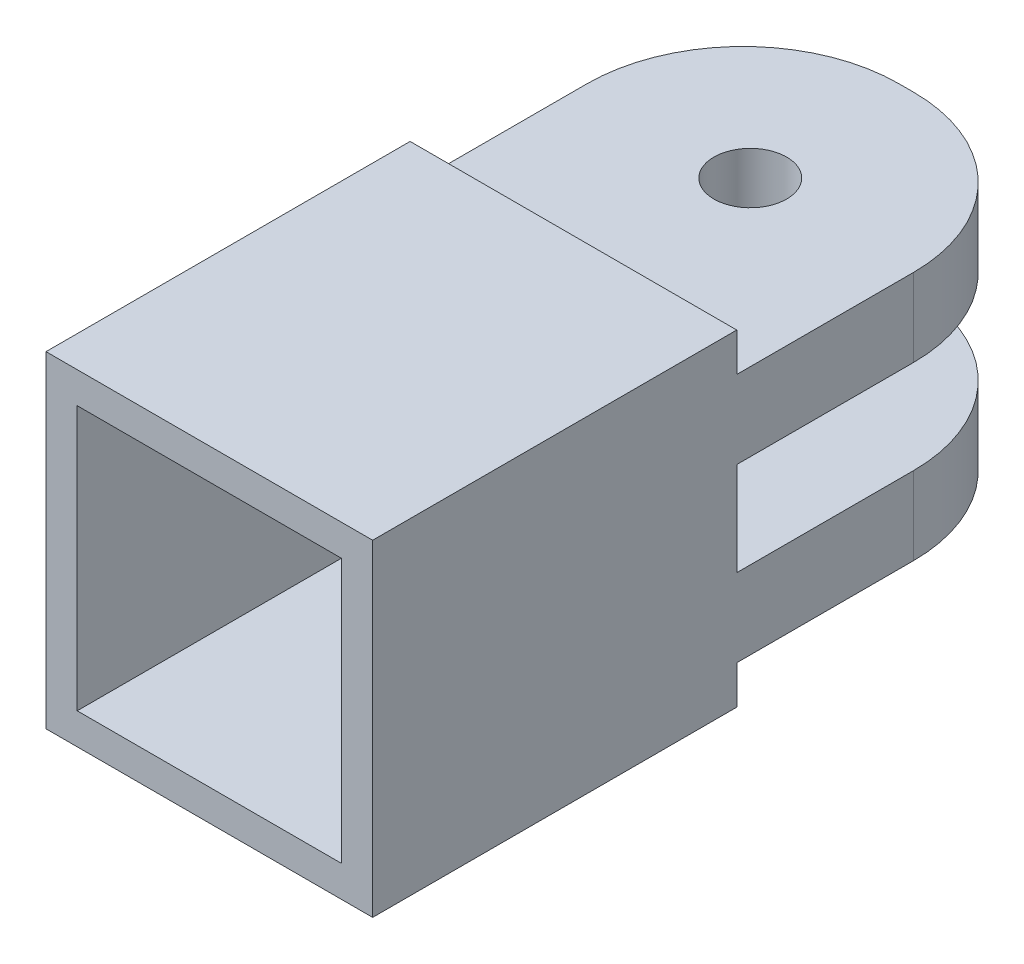
from build123d import *

# Parameters (mm, degrees)
SKETCH1_W           = 31.4
SKETCH1_H           = 31.4
SKETCH1_W_2         = 25.4
SKETCH1_H_2         = 25.4
BOSS_EXTRUDE1_DEPTH = 30
SKETCH2_W           = 31.4
SKETCH2_H           = 31.4
BOSS_EXTRUDE2_DEPTH = 5
SKETCH3_W           = 31.4
SKETCH3_H           = 7.5
BOSS_EXTRUDE3_DEPTH = 5
SKETCH6_R           = 3.5
BOSS_EXTRUDE6_DEPTH = 7.5


with BuildPart() as part:
    # Sketch1 → Boss-Extrude1 (new body)
    with BuildSketch(Plane.XY):
        Rectangle(SKETCH1_W, SKETCH1_H)
        Rectangle(SKETCH1_W_2, SKETCH1_H_2, mode=Mode.SUBTRACT)
    extrude(amount=BOSS_EXTRUDE1_DEPTH)

    # Sketch2 → Boss-Extrude2 (add)
    with BuildSketch(Plane(origin=(0, 0, 0), x_dir=(-1, 0, 0), z_dir=(0, 0, -1))):
        Rectangle(SKETCH2_W, SKETCH2_H)
    extrude(amount=BOSS_EXTRUDE2_DEPTH)

    # Sketch3 → Boss-Extrude3 (add)
    with BuildSketch(Plane(origin=(0, 0, -5), x_dir=(-1, 0, 0), z_dir=(0, 0, -1))):
        with Locations((0, 8.25)):
            Rectangle(SKETCH3_W, SKETCH3_H)
    boss_extrude3 = extrude(amount=BOSS_EXTRUDE3_DEPTH)

    # Sketch6 → Boss-Extrude6 (add)
    with BuildSketch(Plane(origin=(0, 12, 0), x_dir=(1, 0, 0), z_dir=(0, 1, 0))):
        with BuildLine():
            Line((-15.7, 10), (-15.7, 22))
            ThreePointArc((-15.7, 22), (-11.306601718, 32.606601718), (-0.7, 37))
            Line((-0.7, 37), (0.7, 37))
            ThreePointArc((0.7, 37), (11.306601718, 32.606601718), (15.7, 22))
            Line((15.7, 22), (15.7, 10))
            Line((15.7, 10), (-15.7, 10))
        make_face()
        with Locations((0, 22)):
            Circle(SKETCH6_R, mode=Mode.SUBTRACT)
    boss_extrude6 = extrude(amount=-BOSS_EXTRUDE6_DEPTH)

    # Mirror1: Boss-Extrude3, Boss-Extrude6 across plane
    add(boss_extrude3.mirror(Plane.ZX))
    add(boss_extrude6.mirror(Plane.ZX))


solid = part.part
